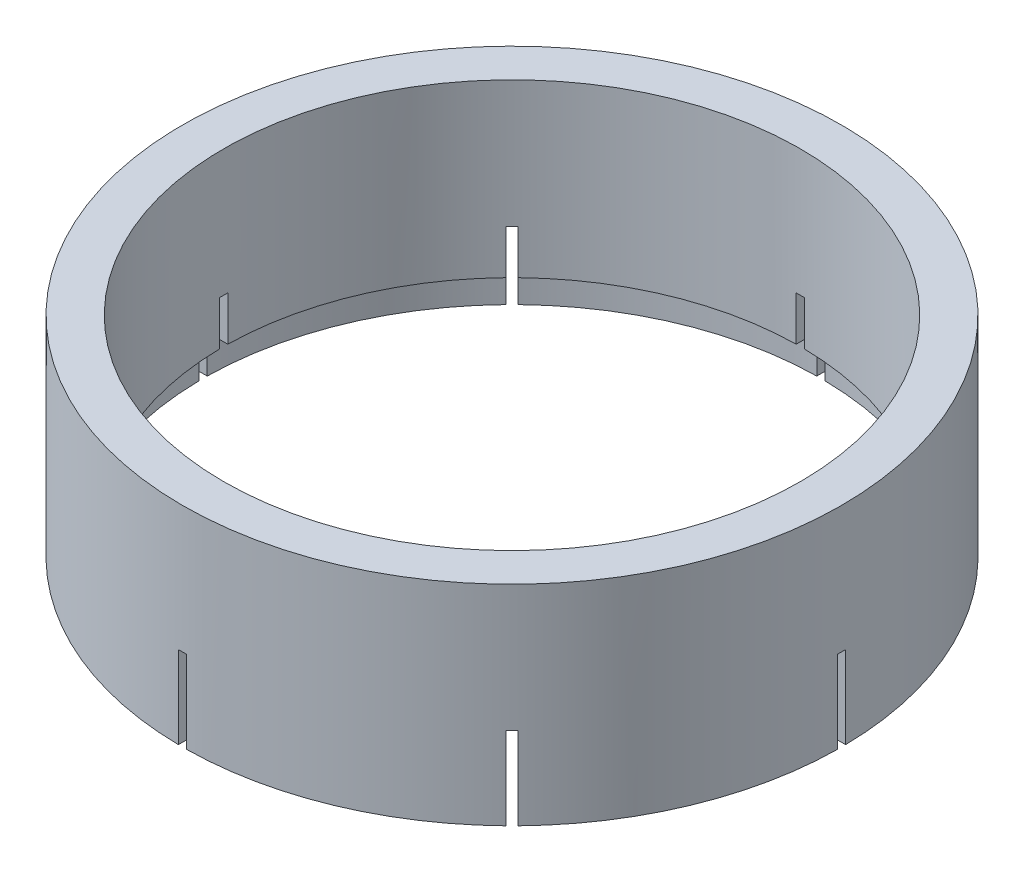
from build123d import *

# Parameters (mm, degrees)
SKETCH1_R           = 40
SKETCH1_R_2         = 35
BOSS_EXTRUDE1_DEPTH = 25.4
SKETCH2_R           = 37.5
SKETCH2_R_2         = 35
CUT_EXTRUDE1_DEPTH  = 4.6
SKETCH3_W           = 1
SKETCH3_H           = 10
CUT_EXTRUDE2_DEPTH  = 63.009354133
CIRPATTERN1_COUNT   = 4
CIRPATTERN1_ANGLE   = 135


with BuildPart() as part:
    # Sketch1 → Boss-Extrude1 (new body)
    with BuildSketch(Plane(origin=(0, 0, 0), x_dir=(1, 0, 0), z_dir=(0, 1, 0))):
        Circle(SKETCH1_R)
        Circle(SKETCH1_R_2, mode=Mode.SUBTRACT)
    extrude(amount=BOSS_EXTRUDE1_DEPTH)

    # Sketch2 → Cut-Extrude1 (cut)
    with BuildSketch(Plane.XZ):
        Circle(SKETCH2_R)
        Circle(SKETCH2_R_2, mode=Mode.SUBTRACT)
    extrude(amount=-CUT_EXTRUDE1_DEPTH, mode=Mode.SUBTRACT)

    # Sketch3 → Cut-Extrude2 (cut, symmetric)
    with BuildSketch(Plane.XY):
        with Locations((0, 5)):
            Rectangle(SKETCH3_W, SKETCH3_H)
    cut_extrude2 = extrude(amount=CUT_EXTRUDE2_DEPTH, both=True, mode=Mode.SUBTRACT)

    # CirPattern1: Cut-Extrude2 ×4 about axis
    cirpattern1_axis = Axis((0, 25.4, 0), (0, -1, 0))
    for i in range(1, CIRPATTERN1_COUNT):
        add(cut_extrude2.rotate(cirpattern1_axis, i * CIRPATTERN1_ANGLE / (CIRPATTERN1_COUNT - 1)), mode=Mode.SUBTRACT)


solid = part.part
